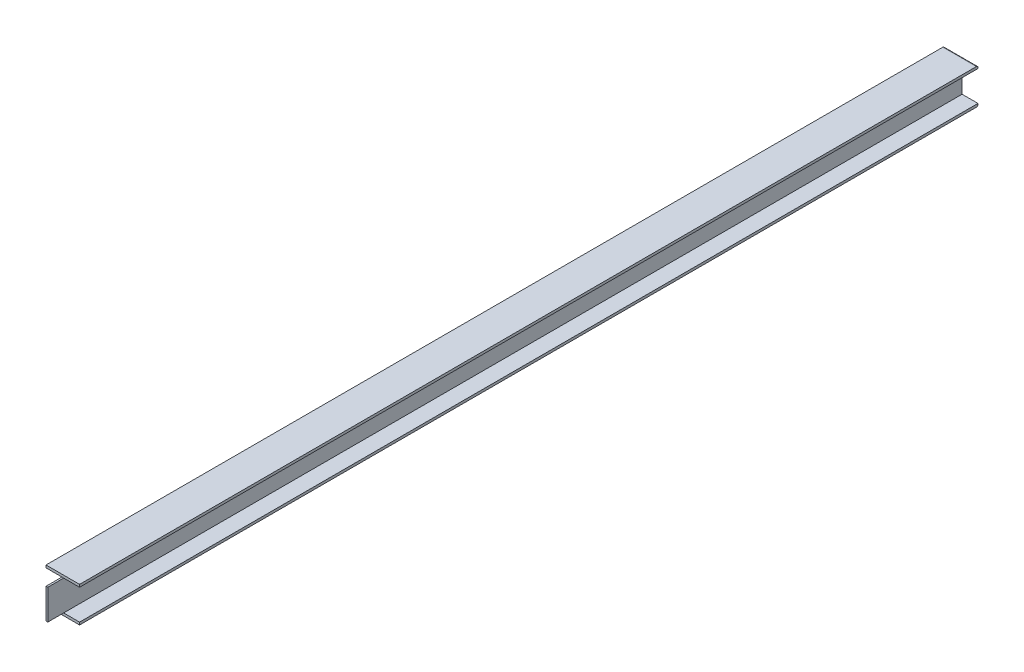
from build123d import *

# Parameters (mm, degrees)
BOSS_EXTRUDE1_DEPTH       = 4000
BOSS_EXTRUDE2_DEPTH       = 89.328594679
BOSS_EXTRUDE2_START       = 89.328594679
BOSS_EXTRUDE2_2_OUTLINE_W = 8.128
BOSS_EXTRUDE2_2_OUTLINE_H = 138.938
BOSS_EXTRUDE2_2_DEPTH     = 73.152
BOSS_EXTRUDE5_DEPTH       = 44.208643554
FILLET1_R                 = 7.62


# Read off the part's stored shape, not the designer's step: Boss-Extrude2
with BuildPart() as part:
    # Sketch1 → Boss-Extrude1 (new body)
    with BuildSketch(Plane.XY):
        Polygon((0, -0.000240533), (154.432, -0.000240533), (154.432, -11.557240533), (81.28, -11.557240533), (81.28, -150.495240533), (154.432, -150.495240533), (154.432, -162.052240533), (0, -162.052240533), (0, -150.495240533), (73.152, -150.495240533), (73.152, -11.557240533), (0, -11.557240533), align=None)
    extrude(amount=BOSS_EXTRUDE1_DEPTH)

    # Boss-Extrude2 outline → Boss-Extrude2 (add)
    with BuildSketch(Plane.XY.offset(4000)):
        Polygon((81.28, -150.495240533), (81.28, -11.557240533), (154.432, -11.557240533), (154.432, -0.000240533), (0, -0.000240533), (0, -11.557240533), (73.152, -11.557240533), (73.152, -150.495240533), (0, -150.495240533), (0, -162.052240533), (154.432, -162.052240533), (154.432, -150.495240533), align=None)
    extrude(amount=BOSS_EXTRUDE2_DEPTH)

    # Boss-Extrude2 2 outline → Boss-Extrude2 2 (add)
    with BuildSketch(Plane.XY.offset(4000).offset(BOSS_EXTRUDE2_START)):
        with Locations((77.216, -81.026240533)):
            Rectangle(BOSS_EXTRUDE2_2_OUTLINE_W, BOSS_EXTRUDE2_2_OUTLINE_H)
    extrude(amount=BOSS_EXTRUDE2_2_DEPTH)

    # Sketch4 → Boss-Extrude5 (add)
    with BuildSketch(Plane(origin=(0, 0, 0), x_dir=(-1, 0, 0), z_dir=(0, 0, -1))):
        Polygon((0, -11.557240533), (0, -0.000240533), (-154.432, -0.000240533), (-154.432, -11.557240533), (-81.28, -11.557240533), (-81.28, -150.495240533), (-154.432, -150.495240533), (-154.432, -162.052240533), (0, -162.052240533), (0, -150.495240533), (-73.152, -150.495240533), (-73.152, -11.557240533), align=None)
    extrude(amount=BOSS_EXTRUDE5_DEPTH)

    # Fillet1
    fillet1_edges = [part.edges().sort_by_distance(p)[0] for p in [
        (77.216, -162.052240533, -44.208643554),
        (77.216, -0.000240533, -44.208643554),
    ]]
    fillet(fillet1_edges, radius=FILLET1_R)


solid = part.part
